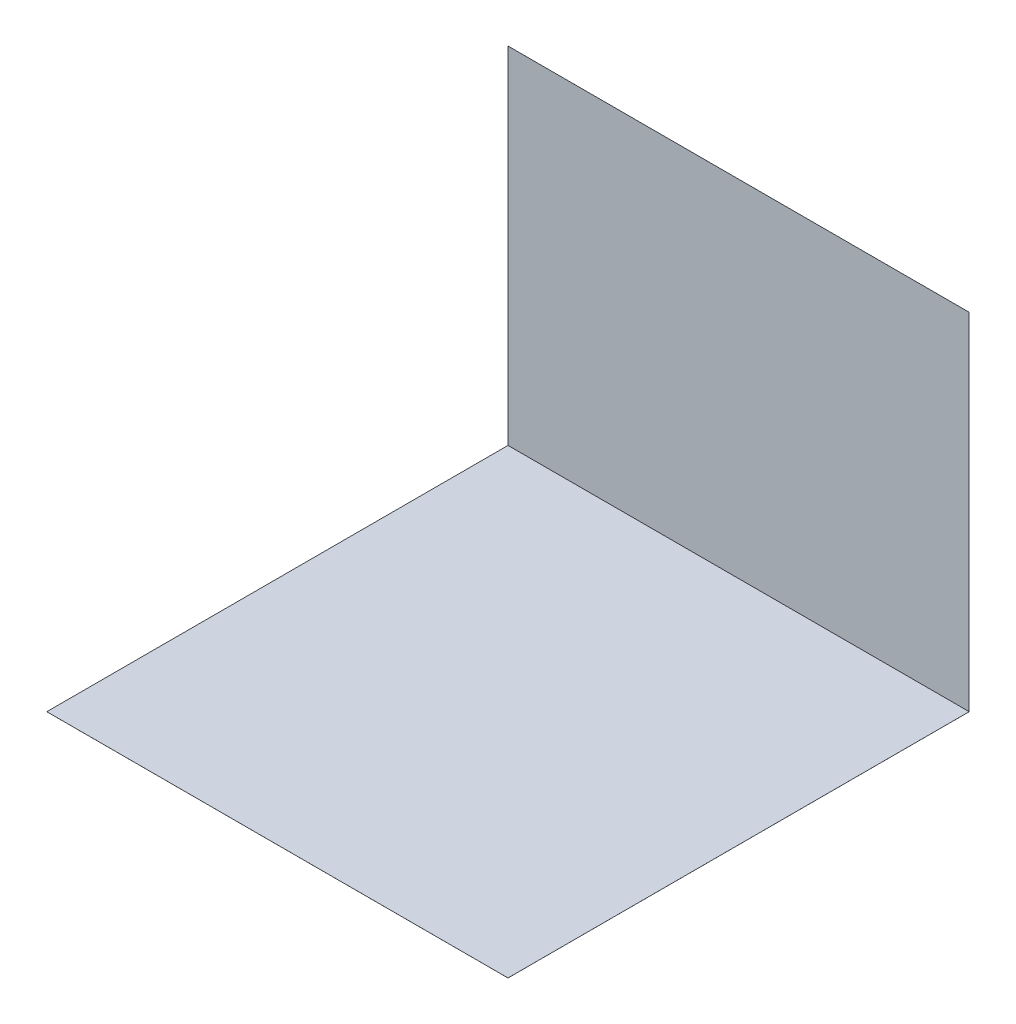
from build123d import *

# Parameters (mm, degrees)
SKETCH2_W     = 4000
SKETCH2_H     = 4000
FLOOR_2_DEPTH = 0.254
SKETCH4_W     = 4000
SKETCH4_H     = 0.0254
WALL1_DEPTH   = 3000


with BuildPart() as part:
    # Sketch2 → Floor 2 (new body)
    with BuildSketch(Plane(origin=(0, 0, 0), x_dir=(1, 0, 0), z_dir=(0, 1, 0))):
        with Locations((1916.97962963, -1979.656481481)):
            Rectangle(SKETCH2_W, SKETCH2_H)
    extrude(amount=FLOOR_2_DEPTH)


with BuildPart() as body_2:
    # Sketch4 → Wall1 (new body)
    with BuildSketch(Plane(origin=(0, 0.254, 0), x_dir=(1, 0, 0), z_dir=(0, 1, 0))):
        with Locations((1916.97962963, 20.356218519)):
            Rectangle(SKETCH4_W, SKETCH4_H)
    extrude(amount=WALL1_DEPTH)


solid = Compound([part.part, body_2.part])
